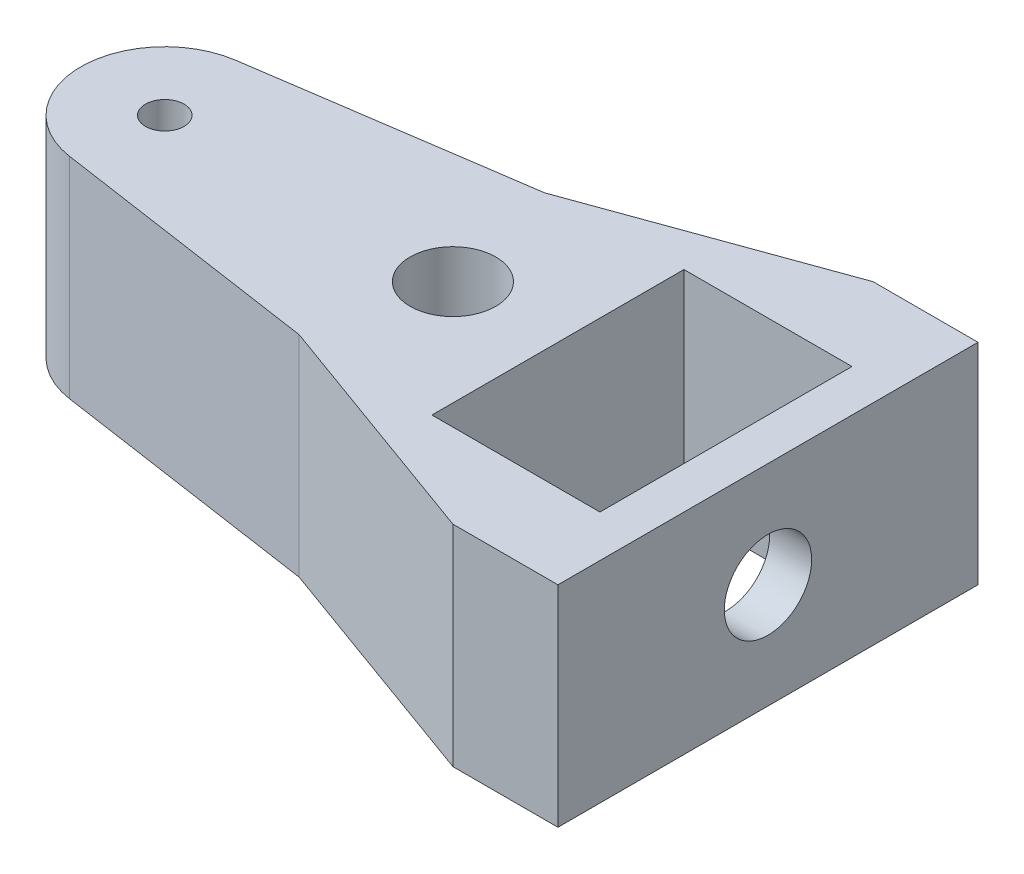
from build123d import *

# Parameters (mm, degrees)
SKETCH1_R           = 5.1
SKETCH1_R_2         = 2.3
SKETCH1_W           = 20
SKETCH1_H           = 30
BOSS_EXTRUDE1_DEPTH = 25
SKETCH2_R           = 5.2
CUT_EXTRUDE2_DEPTH  = 20


with BuildPart() as part:
    # Sketch1 → Boss-Extrude1 (new body)
    with BuildSketch(Plane(origin=(0, 0, 0), x_dir=(1, 0, 0), z_dir=(0, 1, 0))):
        with BuildLine():
            Line((37.5, 12.5), (37.5, -12.5))
            Line((37.5, -12.5), (37.5, -25))
            Line((37.5, -25), (25, -25))
            Line((25, -25), (-3.682692247, -14.619326224))
            Line((-3.682692247, -14.619326224), (-35.757725948, -9.893181241))
            ThreePointArc((-35.757725948, -9.893181241), (-44.3, 0), (-35.757725948, 9.893181241))
            Line((-35.757725948, 9.893181241), (-3.682692247, 14.619326224))
            Line((-3.682692247, 14.619326224), (25, 25))
            Line((25, 25), (37.5, 25))
            Line((37.5, 25), (37.5, 12.5))
        make_face()
        Circle(SKETCH1_R, mode=Mode.SUBTRACT)
        with Locations((-34.3, 0)):
            Circle(SKETCH1_R_2, mode=Mode.SUBTRACT)
        with Locations((22.5, 0)):
            Rectangle(SKETCH1_W, SKETCH1_H, mode=Mode.SUBTRACT)
    extrude(amount=BOSS_EXTRUDE1_DEPTH)

    # Sketch2 → Cut-Extrude2 (cut)
    with BuildSketch(Plane(origin=(37.5, 0, 0), x_dir=(0, 0, -1), z_dir=(1, 0, 0))):
        with Locations((0, 12.5)):
            Circle(SKETCH2_R)
    extrude(amount=-CUT_EXTRUDE2_DEPTH, mode=Mode.SUBTRACT)


solid = part.part
